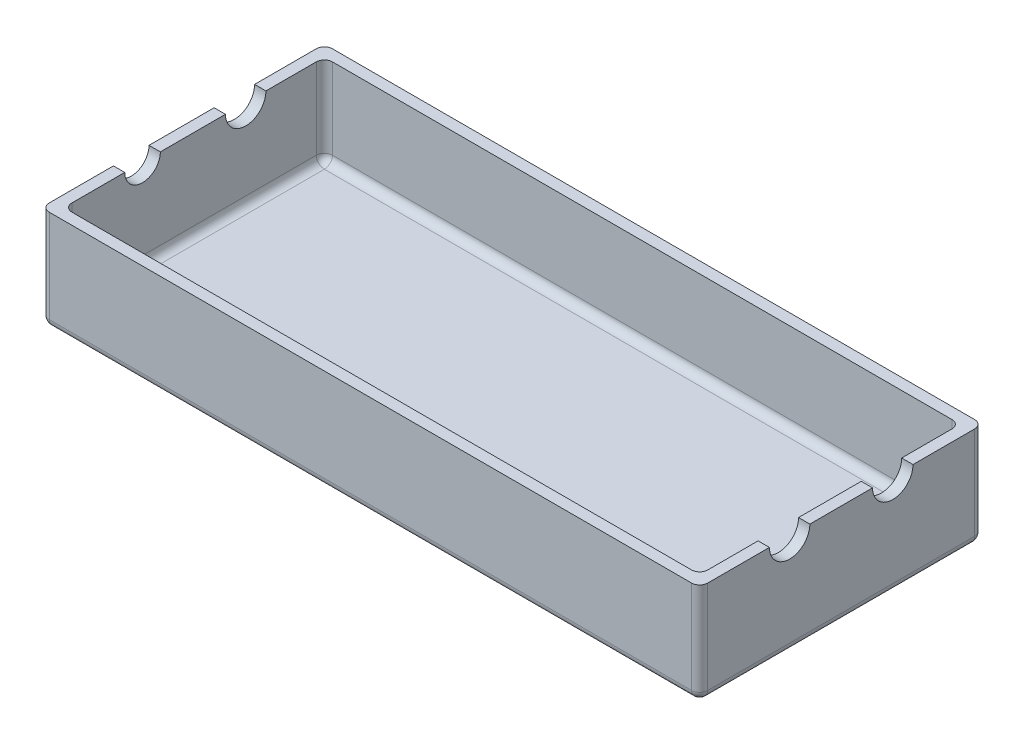
from build123d import *

# Parameters (mm, degrees)
SKETCH1_W           = 814
SKETCH1_H           = 350
BOSS_EXTRUDE1_DEPTH = 125
SKETCH2_W           = 786
SKETCH2_H           = 322
CUT_EXTRUDE1_DEPTH  = 110
FILLET1_R           = 10
FILLET2_R           = 10
FILLET3_R           = 10
SKETCH4_R           = 25
SKETCH4_R_2         = 22
CUT_EXTRUDE2_DEPTH  = 110
CUT_EXTRUDE3_START  = -110
SKETCH5_R           = 25
CUT_EXTRUDE3_DEPTH  = 110


with BuildPart() as part:
    # Sketch1 → Boss-Extrude1 (new body)
    with BuildSketch(Plane(origin=(0, 0, 0), x_dir=(1, 0, 0), z_dir=(0, 1, 0))):
        Rectangle(SKETCH1_W, SKETCH1_H)
    extrude(amount=BOSS_EXTRUDE1_DEPTH)

    # Sketch2 → Cut-Extrude1 (cut)
    with BuildSketch(Plane(origin=(0, 125, 0), x_dir=(1, 0, 0), z_dir=(0, 1, 0))):
        Rectangle(SKETCH2_W, SKETCH2_H)
    extrude(amount=-CUT_EXTRUDE1_DEPTH, mode=Mode.SUBTRACT)

    # Fillet1
    fillet1_edges = [part.edges().sort_by_distance(p)[0] for p in [
        (0, 0, -175),
        (407, 0, 0),
        (0, 0, 175),
        (-407, 0, 0),
    ]]
    fillet(fillet1_edges, radius=FILLET1_R)

    # Fillet2
    # the kernel refuses this fillet: 10 mm, written as the material it takes off along each edge
    with BuildSketch(Plane(origin=(397, 10, -165), x_dir=(0, 0, -1), z_dir=(1, 0, 0))) as fillet2_piece_1_section:
        Polygon((0, 0), (FILLET2_R, 0), (FILLET2_R, -FILLET2_R), (0, -FILLET2_R), align=None)
    fillet2_piece_1 = extrude(amount=FILLET2_R, mode=Mode.PRIVATE)
    fillet2_piece_1 = fillet2_piece_1 - Plane(origin=(397, 10, -165), x_dir=(0, 0.7071067811865475, 0.7071067811865475), z_dir=(1, 0, 0)) * Sphere(FILLET2_R, mode=Mode.PRIVATE)
    add(fillet2_piece_1, mode=Mode.SUBTRACT)
    with BuildSketch(Plane(origin=(397, 10, 165), x_dir=(1, 0, 0), z_dir=(0, 0, 1))) as fillet2_piece_2_section:
        Polygon((0, 0), (FILLET2_R, 0), (FILLET2_R, -FILLET2_R), (0, -FILLET2_R), align=None)
    fillet2_piece_2 = extrude(amount=FILLET2_R, mode=Mode.PRIVATE)
    fillet2_piece_2 = fillet2_piece_2 - Plane(origin=(397, 10, 165), x_dir=(-0.7071067811865475, 0.7071067811865475, 0), z_dir=(0, 0, 1)) * Sphere(FILLET2_R, mode=Mode.PRIVATE)
    add(fillet2_piece_2, mode=Mode.SUBTRACT)
    with BuildSketch(Plane(origin=(-397, 10, -165), x_dir=(0, 0, -1), z_dir=(-1, 0, 0))) as fillet2_piece_3_section:
        Polygon((0, 0), (FILLET2_R, 0), (FILLET2_R, FILLET2_R), (0, FILLET2_R), align=None)
    fillet2_piece_3 = extrude(amount=FILLET2_R, mode=Mode.PRIVATE)
    fillet2_piece_3 = fillet2_piece_3 - Plane(origin=(-397, 10, -165), x_dir=(0, 0.7071067811865475, 0.7071067811865475), z_dir=(-1, 0, 0)) * Sphere(FILLET2_R, mode=Mode.PRIVATE)
    add(fillet2_piece_3, mode=Mode.SUBTRACT)
    with BuildSketch(Plane(origin=(-397, 10, 165), x_dir=(-1, 0, 0), z_dir=(0, 0, 1))) as fillet2_piece_4_section:
        Polygon((0, 0), (FILLET2_R, 0), (FILLET2_R, FILLET2_R), (0, FILLET2_R), align=None)
    fillet2_piece_4 = extrude(amount=FILLET2_R, mode=Mode.PRIVATE)
    fillet2_piece_4 = fillet2_piece_4 - Plane(origin=(-397, 10, 165), x_dir=(0.7071067811865475, 0.7071067811865475, 0), z_dir=(0, 0, 1)) * Sphere(FILLET2_R, mode=Mode.PRIVATE)
    add(fillet2_piece_4, mode=Mode.SUBTRACT)
    with BuildSketch(Plane(origin=(-407, 10, -175), x_dir=(0, 0, 1), z_dir=(0, 1, 0)), Plane(origin=(-407, 10, 175), x_dir=(1, 0, 0), z_dir=(0, 1, 0))) as fillet2_piece_5:
        with BuildLine():
            CenterArc((FILLET2_R, FILLET2_R), FILLET2_R, 180, 90)
            Line((0, FILLET2_R), (0, 0))
            Line((0, 0), (FILLET2_R, 0))
        make_face()
    extrude(amount=140, mode=Mode.SUBTRACT)
    with BuildSketch(Plane(origin=(407, 10, -175), x_dir=(0, 0, 1), z_dir=(0, 1, 0)), Plane(origin=(407, 10, 175), x_dir=(-1, 0, 0), z_dir=(0, 1, 0))) as fillet2_piece_6:
        with BuildLine():
            CenterArc((FILLET2_R, -FILLET2_R), FILLET2_R, 90, 90)
            Line((0, -FILLET2_R), (0, 0))
            Line((0, 0), (FILLET2_R, 0))
        make_face()
    extrude(amount=140, mode=Mode.SUBTRACT)

    # Fillet3
    fillet3_edges = [part.edges().sort_by_distance(p)[0] for p in [
        (393, 15, 0),
        (393, 70, -161),
        (0, 15, 161),
        (393, 70, 161),
        (-393, 15, 0),
        (-393, 70, 161),
        (0, 15, -161),
        (-393, 70, -161),
    ]]
    fillet(fillet3_edges, radius=FILLET3_R)

    # Sketch4 → Cut-Extrude2 (cut)
    with BuildSketch(Plane.ZY.offset(407)):
        with Locations((-63.75, 125)):
            Circle(SKETCH4_R)
        with Locations((63.75, 125)):
            Circle(SKETCH4_R_2)
    extrude(amount=-CUT_EXTRUDE2_DEPTH, mode=Mode.SUBTRACT)

    # Sketch5 → Cut-Extrude3 (cut)
    with BuildSketch(Plane(origin=(407, 0, 0), x_dir=(0, 0, -1), z_dir=(1, 0, 0)).offset(CUT_EXTRUDE3_START)):
        with Locations((-63.75, 125)):
            Circle(SKETCH5_R)
        with Locations((63.75, 125)):
            Circle(SKETCH5_R)
    extrude(amount=CUT_EXTRUDE3_DEPTH, mode=Mode.SUBTRACT)


solid = part.part
